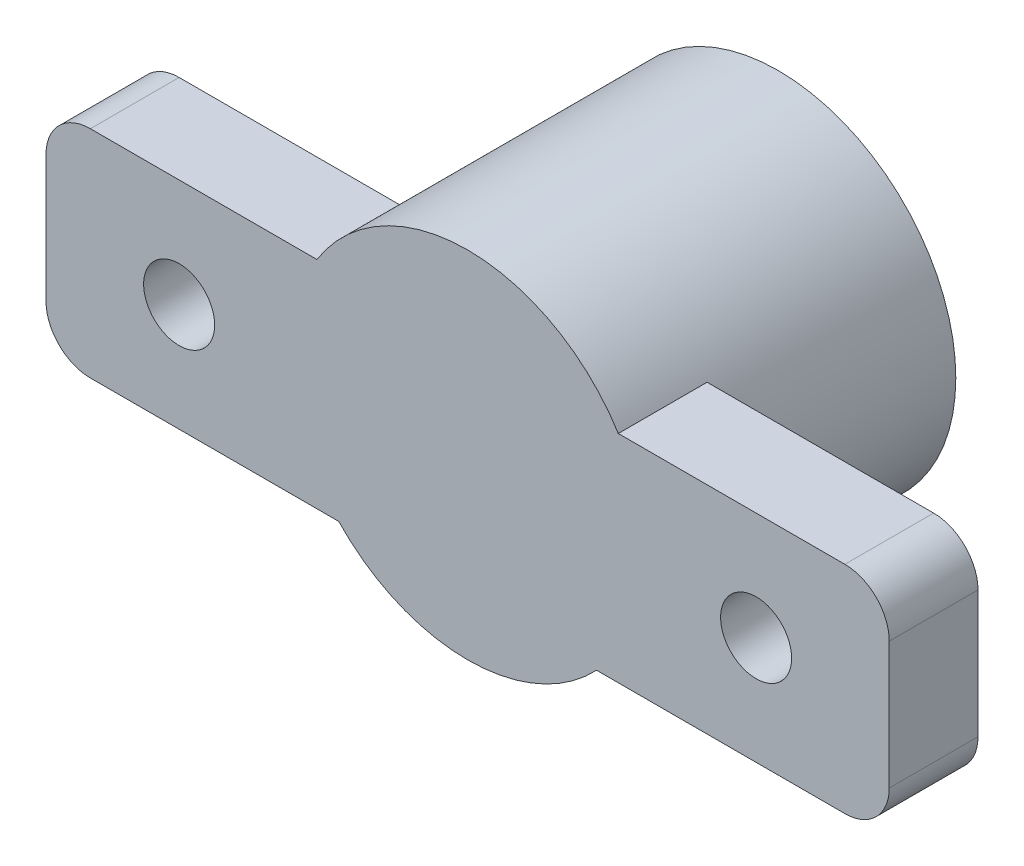
from build123d import *

# Parameters (mm, degrees)
IZIM1_R                     = 8
Y_KSEKLIK_EKSTR_ZYON1_DEPTH = 10
Y_KSEKLIK_EKSTR_ZYON2_DEPTH = 4
RADYUS1_R                   = 2
RADYUS2_R                   = 2
IZIM4_R                     = 1.6
KES_EKSTR_ZYON2_DEPTH       = 10


with BuildPart() as part:
    # Çizim1 → Yükseklik-Ekstrüzyon1 (new body)
    with BuildSketch(Plane.XY):
        Circle(IZIM1_R)
        with BuildLine():
            Line((-1.6, 2.049390153), (-1.6, -2.049390153))
            ThreePointArc((-1.6, -2.049390153), (2.6, 0), (-1.6, 2.049390153))
        make_face(mode=Mode.SUBTRACT)
    extrude(amount=Y_KSEKLIK_EKSTR_ZYON1_DEPTH)

    # Çizim2 → Yükseklik-Ekstrüzyon2 (add)
    with BuildSketch(Plane.XY.offset(10)):
        with BuildLine():
            Line((19, -5.5), (19, 4.23))
            Line((19, 4.23), (6.79022091, 4.23))
            ThreePointArc((6.79022091, 4.23), (0, 8), (-6.79022091, 4.23))
            Line((-6.79022091, 4.23), (-19, 4.23))
            Line((-19, 4.23), (-19, -5.5))
            Line((-19, -5.5), (-5.809475019, -5.5))
            ThreePointArc((-5.809475019, -5.5), (0, -8), (5.809475019, -5.5))
            Line((5.809475019, -5.5), (19, -5.5))
        make_face()
    extrude(amount=Y_KSEKLIK_EKSTR_ZYON2_DEPTH)

    # Radyus1
    radyus1_edges = [part.edges().sort_by_distance(p)[0] for p in [
        (19, -5.5, 12),
        (-19, -5.5, 12),
    ]]
    fillet(radyus1_edges, radius=RADYUS1_R)

    # Radyus2
    radyus2_edges = [part.edges().sort_by_distance(p)[0] for p in [
        (19, 4.23, 12),
        (-19, 4.23, 12),
    ]]
    fillet(radyus2_edges, radius=RADYUS2_R)

    # Çizim4 → Kes-Ekstrüzyon2 (cut)
    with BuildSketch(Plane.XY.offset(14)):
        with Locations((-13, -0.635)):
            Circle(IZIM4_R)
        with Locations((13, -0.635)):
            Circle(IZIM4_R)
    extrude(amount=-KES_EKSTR_ZYON2_DEPTH, mode=Mode.SUBTRACT)


solid = part.part
